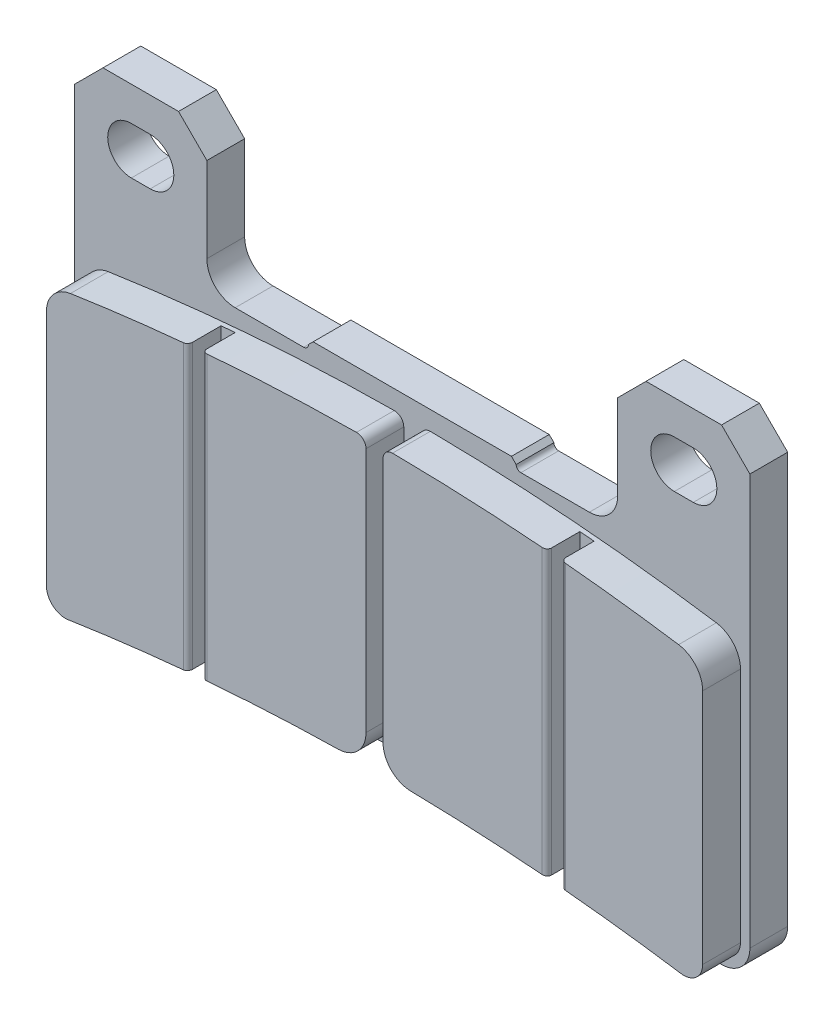
from build123d import *

# Parameters (mm, degrees)
BOSS_EXTRUDE1_DEPTH     = 4
CHAMFER1_SIZE           = 3
FILLET1_R               = 3
FILLET2_R               = 0.5
CHAMFER2_SIZE           = 0.5
BOSS_EXTRUDE2_DEPTH     = 4
FILLET3_R               = 3
FILLET4_R               = 1
CUT_EXTRUDE_THIN1_START = 0.5
SKETCH3_W               = 1.5
SKETCH3_H               = 51.000458502
CUT_EXTRUDE_THIN1_DEPTH = 44.307105588
FILLET5_R               = 0.5
SKETCH4_R               = 3
CUT_EXTRUDE1_DEPTH      = 2.5
FILLET6_R               = 0.2


with BuildPart() as part:
    # Sketch1 → Boss-Extrude1 (new body)
    with BuildSketch(Plane.XY):
        with BuildLine():
            Line((11, 11), (-11, 11))
            Line((-11, 11), (-11, 10))
            Line((-11, 10), (-21.75, 10))
            Line((-21.75, 10), (-21.75, 11))
            Line((-21.75, 11), (-21.75, 25))
            Line((-21.75, 25), (-35.75, 25))
            Line((-35.75, 25), (-35.75, -25))
            ThreePointArc((-35.75, -25), (0, -22), (35.75, -25))
            Line((35.75, -25), (35.75, 25))
            Line((35.75, 25), (21.75, 25))
            Line((21.75, 25), (21.75, 11))
            Line((21.75, 11), (21.75, 10))
            Line((21.75, 10), (11, 10))
            Line((11, 10), (11, 11))
        make_face()
        with BuildLine():
            ThreePointArc((-29.75, 16.4), (-32.25, 18.9), (-29.75, 21.4))
            Line((-29.75, 21.4), (-27.75, 21.4))
            ThreePointArc((-27.75, 21.4), (-25.25, 18.9), (-27.75, 16.4))
            Line((-27.75, 16.4), (-29.75, 16.4))
        make_face(mode=Mode.SUBTRACT)
        with BuildLine():
            Line((27.75, 21.4), (29.75, 21.4))
            ThreePointArc((29.75, 21.4), (32.25, 18.9), (29.75, 16.4))
            Line((29.75, 16.4), (27.75, 16.4))
            ThreePointArc((27.75, 16.4), (25.25, 18.9), (27.75, 21.4))
        make_face(mode=Mode.SUBTRACT)
    extrude(amount=BOSS_EXTRUDE1_DEPTH)

    # Chamfer1
    chamfer1_edges = [part.edges().sort_by_distance(p)[0] for p in [
        (-35.75, 25, 2),
        (-21.75, 25, 2),
        (21.75, 25, 2),
        (35.75, 25, 2),
    ]]
    chamfer(chamfer1_edges, length=CHAMFER1_SIZE)

    # Fillet1
    fillet1_edges = [part.edges().sort_by_distance(p)[0] for p in [
        (-21.75, 10, 2),
        (21.75, 10, 2),
        (35.75, -25, 2),
        (-35.75, -25, 2),
    ]]
    fillet(fillet1_edges, radius=FILLET1_R)

    # Fillet2
    fillet2_edges = [part.edges().sort_by_distance(p)[0] for p in [
        (-11, 10, 2),
        (11, 10, 2),
    ]]
    fillet(fillet2_edges, radius=FILLET2_R)

    # Chamfer2
    chamfer2_edges = [part.edges().sort_by_distance(p)[0] for p in [
        (-11, 11, 2),
        (11, 11, 2),
    ]]
    chamfer(chamfer2_edges, length=CHAMFER2_SIZE - 0.0001)  # a hair under: the kernel refuses the full size

    # Sketch2 → Boss-Extrude2 (add)
    with BuildSketch(Plane.XY.offset(4)):
        with BuildLine():
            Line((-0.9, -21.001879268), (-0.9, 8.998120732))
            ThreePointArc((-0.9, 8.998120732), (-17.880609494, 8.256953983), (-34.75, 6.179915017))
            Line((-34.75, 6.179915017), (-34.75, -21.479677333))
            ThreePointArc((-34.75, -21.479677333), (-34.053405155, -22.996626575), (-32.448864997, -23.456876794))
            ThreePointArc((-32.448864997, -23.456876794), (-16.719552995, -21.649540192), (-0.9, -21.001879268))
        make_face()
        with BuildLine():
            ThreePointArc((34.75, 6.179915017), (17.880609494, 8.256953983), (0.9, 8.998120732))
            Line((0.9, 8.998120732), (0.9, -21.001879268))
            ThreePointArc((0.9, -21.001879268), (16.719552995, -21.649540192), (32.448864997, -23.456876794))
            ThreePointArc((32.448864997, -23.456876794), (34.053405155, -22.996626575), (34.75, -21.479677333))
            Line((34.75, -21.479677333), (34.75, 6.179915017))
        make_face()
    extrude(amount=BOSS_EXTRUDE2_DEPTH)

    # Fillet3
    fillet3_edges = [part.edges().sort_by_distance(p)[0] for p in [
        (-0.9, -21.001879268, 6),
        (-34.75, 6.179915017, 6),
        (0.9, -21.001879268, 6),
        (34.75, 6.179915017, 6),
    ]]
    fillet(fillet3_edges, radius=FILLET3_R)

    # Fillet4
    fillet4_edges = [part.edges().sort_by_distance(p)[0] for p in [
        (-0.9, 8.998120732, 6),
        (0.9, 8.998120732, 6),
    ]]
    fillet(fillet4_edges, radius=FILLET4_R)

    # Sketch3 → Cut-Extrude-Thin1 (cut, through all)
    with BuildSketch(Plane.XY.offset(4).offset(CUT_EXTRUDE_THIN1_START)):
        with Locations((-19, -9.490221292)):
            Rectangle(SKETCH3_W, SKETCH3_H)
        with Locations((19, -9.490221292)):
            Rectangle(SKETCH3_W, SKETCH3_H)
    extrude(amount=CUT_EXTRUDE_THIN1_DEPTH, mode=Mode.SUBTRACT)

    # Fillet5
    fillet5_edges = [part.edges().sort_by_distance(p)[0] for p in [
        (-18.25, -6.7741198, 8),
        (-19.75, -6.906881766, 8),
        (19.75, -6.906881766, 8),
        (18.25, -6.7741198, 8),
    ]]
    fillet(fillet5_edges, radius=FILLET5_R)

    # Sketch4 → Cut-Extrude1 (cut)
    with BuildSketch(Plane(origin=(0, 0, 0), x_dir=(-1, 0, 0), z_dir=(0, 0, -1))):
        with Locations((-16.25, 0.5)):
            Circle(SKETCH4_R)
        with Locations((24.252501254, 0.5)):
            Circle(SKETCH4_R)
        with Locations((15.75, -13.5)):
            Circle(SKETCH4_R)
        with Locations((-25.25, -13.5)):
            Circle(SKETCH4_R)
    extrude(amount=-CUT_EXTRUDE1_DEPTH, mode=Mode.SUBTRACT)

    # Fillet6
    fillet6_edges = [part.edges().sort_by_distance(p)[0] for p in [
        (19.25, 0.5, 0),
        (-21.252501254, 0.5, 0),
        (-12.75, -13.5, 0),
        (28.25, -13.5, 0),
    ]]
    fillet(fillet6_edges, radius=FILLET6_R)


solid = part.part
